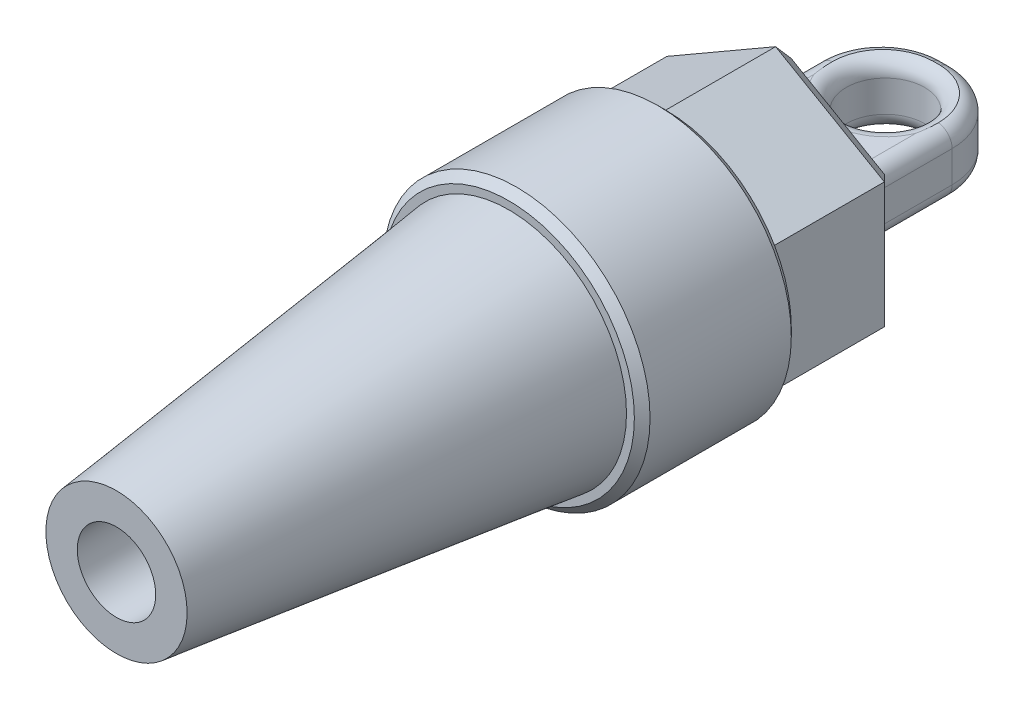
from build123d import *

# Parameters (mm, degrees)
EXTRUDE_2_DEPTH = 8
CHAMFER_1_SIZE  = 1
SKETCH_5_R      = 2.5
EXTRUDE_3_DEPTH = 2
FILLET_3_R      = 1


with BuildPart() as part:
    # 草图2 → 旋转1 (revolve)
    with BuildSketch(Plane(origin=(0, 0, 0), x_dir=(0, 0, -1), z_dir=(1, 0, 0)), mode=Mode.PRIVATE) as revolve_1_sk:
        Polygon((3.53910226, 2.5), (3.53910226, 8), (3.03910226, 8.5), (-5.96089774, 8.5), (-6.46089774, 8), (-6.46089774, 7.5), (-31.46089774, 4.5), (-31.46089774, 2.5), align=None)
    revolve(revolve_1_sk.sketch.rotate(Axis((0, 0, 0), (0, 0, -1)), 90), axis=Axis((0, 0, 0), (0, 0, -1)))

    # 草图4 → 凸台-拉伸2 (add)
    with BuildSketch(Plane(origin=(0, 0, -3.53910226), x_dir=(-1, 0, 0), z_dir=(0, 0, -1))):
        Polygon((0, 8), (-6.92820323, 4), (-6.92820323, -4), (0, -8), (6.92820323, -4), (6.92820323, 4), align=None)
    extrude(amount=EXTRUDE_2_DEPTH)

    # 倒角1
    chamfer_1_edges = [part.edges().sort_by_distance(p)[0] for p in [
        (-3.464101615, 6, -11.53910226),
        (3.464101615, 6, -11.53910226),
        (6.92820323, 0, -11.53910226),
        (3.464101615, -6, -11.53910226),
        (-3.464101615, -6, -11.53910226),
        (-6.92820323, 0, -11.53910226),
    ]]
    chamfer(chamfer_1_edges, length=CHAMFER_1_SIZE)

    # 草图5 → 凸台-拉伸3 (add, symmetric)
    with BuildSketch(Plane(origin=(0, 0, 0), x_dir=(1, 0, 0), z_dir=(0, 1, 0))):
        with BuildLine():
            Line((-4.25, 11.53910226), (4.25, 11.53910226))
            Line((4.25, 11.53910226), (4.25, 17.53910226))
            ThreePointArc((4.25, 17.53910226), (3.078427125, 20.367529385), (0.25, 21.53910226))
            Line((0.25, 21.53910226), (-0.25, 21.53910226))
            ThreePointArc((-0.25, 21.53910226), (-3.078427125, 20.367529385), (-4.25, 17.53910226))
            Line((-4.25, 17.53910226), (-4.25, 11.53910226))
        make_face()
        with Locations(Location((0, 17.53910226, 0), (0, 0, 270))):
            Circle(SKETCH_5_R, mode=Mode.SUBTRACT)
    extrude(amount=EXTRUDE_3_DEPTH, both=True)

    # 圆角3
    fillet_3_edges = [part.edges().sort_by_distance(p)[0] for p in [
        (-4.25, -2, -14.53910226),
        (4.25, -2, -14.53910226),
        (3.078427125, -2, -20.367529385),
        (0, -2, -21.53910226),
        (-3.078427125, -2, -20.367529385),
    ]]
    fillet(fillet_3_edges, radius=FILLET_3_R)
    fillet_3_2_edges = [part.edges().sort_by_distance(p)[0] for p in [
        (-4.25, 2, -14.53910226),
        (4.25, 2, -14.53910226),
        (3.078427125, 2, -20.367529385),
        (0, 2, -21.53910226),
        (-3.078427125, 2, -20.367529385),
    ]]
    fillet(fillet_3_2_edges, radius=FILLET_3_R)
    fillet_3_3_edges = [part.edges().sort_by_distance(p)[0] for p in [
        (0, 2, -11.53910226),
    ]]
    fillet(fillet_3_3_edges, radius=FILLET_3_R)
    # the kernel refuses this fillet: 1 mm, written as the material it takes off along each edge
    with BuildSketch(Plane(origin=(0, 2, -17.53910226), x_dir=(0, 0, 1), z_dir=(-1, 0, 0))) as fillet_3_4_piece_1:
        with BuildLine():
            CenterArc((2.5 + FILLET_3_R, -FILLET_3_R), FILLET_3_R, 90, 90)
            Line((2.5, -FILLET_3_R), (2.5 - FILLET_3_R * 0.02, -FILLET_3_R))
            Line((2.5 - FILLET_3_R * 0.02, -FILLET_3_R), (2.5 - FILLET_3_R * 0.02, FILLET_3_R * 0.02))
            Line((2.5 - FILLET_3_R * 0.02, FILLET_3_R * 0.02), (2.5 + FILLET_3_R, FILLET_3_R * 0.02))
            Line((2.5 + FILLET_3_R, FILLET_3_R * 0.02), (2.5 + FILLET_3_R, 0))
        make_face()
    revolve(axis=Axis((0, 2, -17.53910226), (0, 1, 0)), mode=Mode.SUBTRACT)
    # the kernel refuses this fillet: 1 mm, written as the material it takes off along each edge
    with BuildSketch(Plane(origin=(0, -2, -17.53910226), x_dir=(0, 0, 1), z_dir=(-1, 0, 0))) as fillet_3_5_piece_1:
        with BuildLine():
            CenterArc((2.5 + FILLET_3_R, FILLET_3_R), FILLET_3_R, 180, 90)
            Line((2.5, FILLET_3_R), (2.5 - FILLET_3_R * 0.02, FILLET_3_R))
            Line((2.5 - FILLET_3_R * 0.02, FILLET_3_R), (2.5 - FILLET_3_R * 0.02, -FILLET_3_R * 0.02))
            Line((2.5 - FILLET_3_R * 0.02, -FILLET_3_R * 0.02), (2.5 + FILLET_3_R, -FILLET_3_R * 0.02))
            Line((2.5 + FILLET_3_R, -FILLET_3_R * 0.02), (2.5 + FILLET_3_R, 0))
        make_face()
    revolve(axis=Axis((0, -2, -17.53910226), (0, 1, 0)), mode=Mode.SUBTRACT)


solid = part.part
